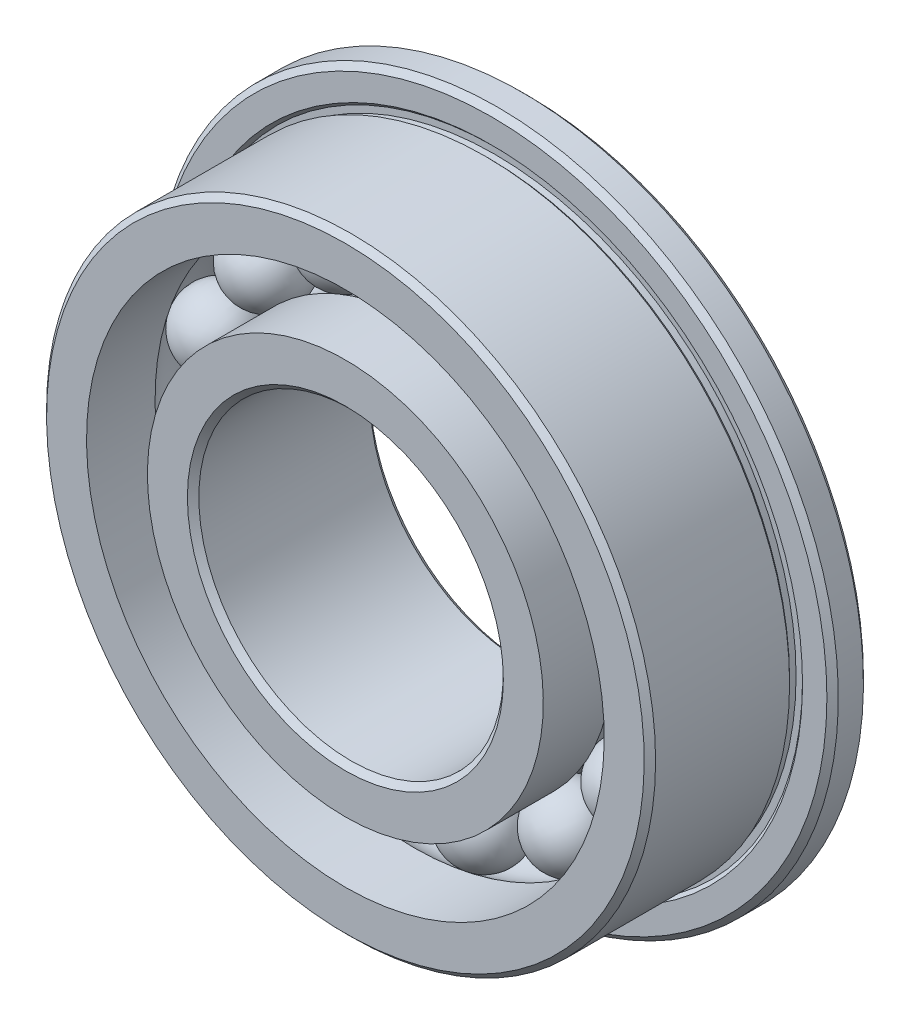
from build123d import *

# Parameters (mm, degrees)
FILLET1_SIZE      = 0.09375
FILLET2_SIZE      = 0.09375
CIRPATTERN3_COUNT = 15


with BuildPart() as part:
    # Sketch2 → Revolve1 (revolve)
    with BuildSketch(Plane(origin=(0, 0, 0), x_dir=(0, 0, -1), z_dir=(1, 0, 0))):
        with BuildLine():
            Line((1.5, 5.6), (0.9, 5.6))
            Line((0.9, 5.6), (0.9, 5.106066017))
            Line((0.9, 5.106066017), (0.953033009, 5.053033009))
            Line((0.953033009, 5.053033009), (0.953033009, 4.946966991))
            Line((0.953033009, 4.946966991), (0.846966991, 4.946966991))
            Line((0.846966991, 4.946966991), (0.793933983, 5))
            Line((0.793933983, 5), (-1.5, 5))
            Line((-1.5, 5), (-1.5, 4.25))
            Line((-1.5, 4.25), (-0.375, 4.25))
            ThreePointArc((-0.375, 4.25), (0, 4.375), (0.375, 4.25))
            Line((0.375, 4.25), (1.5, 4.25))
            Line((1.5, 4.25), (1.5, 5.6))
        make_face()
        with BuildLine():
            Line((1.5, 2.5), (-1.5, 2.5))
            Line((-1.5, 2.5), (-1.5, 3.25))
            Line((-1.5, 3.25), (-0.375, 3.25))
            ThreePointArc((-0.375, 3.25), (0, 3.125), (0.375, 3.25))
            Line((0.375, 3.25), (1.5, 3.25))
            Line((1.5, 3.25), (1.5, 2.5))
        make_face()
    revolve(axis=Axis((0, 0, 0), (0, 0, -1)))

    # Fillet1
    fillet1_edges = [part.edges().sort_by_distance(p)[0] for p in [
        (0, -5.6, -1.5),
        (0, -5.6, -0.9),
        (0, -5, 1.5),
    ]]
    chamfer(fillet1_edges, length=FILLET1_SIZE)

    # Fillet2
    fillet2_edges = [part.edges().sort_by_distance(p)[0] for p in [
        (0, -2.5, -1.5),
        (0, -2.5, 1.5),
    ]]
    chamfer(fillet2_edges, length=FILLET2_SIZE)


with BuildPart() as body_2:
    # Sketch7 → Revolve3 (revolve)
    with BuildSketch(Plane.XY):
        with BuildLine():
            Line((0, 4.375), (0, 3.125))
            ThreePointArc((0, 3.125), (-0.625, 3.75), (0, 4.375))
        make_face()
    revolve(axis=Axis((0, 4.375, 0), (0, -1, 0)))


with BuildPart() as cirpattern3_1:
    # CirPattern3: pattern copy
    add(body_2.part.rotate(Axis((0, 0, 0), (0, 0, -1)), 1 * 360 / CIRPATTERN3_COUNT))


with BuildPart() as cirpattern3_2:
    # CirPattern3: pattern copy
    add(body_2.part.rotate(Axis((0, 0, 0), (0, 0, -1)), 2 * 360 / CIRPATTERN3_COUNT))


with BuildPart() as cirpattern3_3:
    # CirPattern3: pattern copy
    add(body_2.part.rotate(Axis((0, 0, 0), (0, 0, -1)), 3 * 360 / CIRPATTERN3_COUNT))


with BuildPart() as cirpattern3_4:
    # CirPattern3: pattern copy
    add(body_2.part.rotate(Axis((0, 0, 0), (0, 0, -1)), 4 * 360 / CIRPATTERN3_COUNT))


with BuildPart() as cirpattern3_5:
    # CirPattern3: pattern copy
    add(body_2.part.rotate(Axis((0, 0, 0), (0, 0, -1)), 5 * 360 / CIRPATTERN3_COUNT))


with BuildPart() as cirpattern3_6:
    # CirPattern3: pattern copy
    add(body_2.part.rotate(Axis((0, 0, 0), (0, 0, -1)), 6 * 360 / CIRPATTERN3_COUNT))


with BuildPart() as cirpattern3_7:
    # CirPattern3: pattern copy
    add(body_2.part.rotate(Axis((0, 0, 0), (0, 0, -1)), 7 * 360 / CIRPATTERN3_COUNT))


with BuildPart() as cirpattern3_8:
    # CirPattern3: pattern copy
    add(body_2.part.rotate(Axis((0, 0, 0), (0, 0, -1)), 8 * 360 / CIRPATTERN3_COUNT))


with BuildPart() as cirpattern3_9:
    # CirPattern3: pattern copy
    add(body_2.part.rotate(Axis((0, 0, 0), (0, 0, -1)), 9 * 360 / CIRPATTERN3_COUNT))


with BuildPart() as cirpattern3_10:
    # CirPattern3: pattern copy
    add(body_2.part.rotate(Axis((0, 0, 0), (0, 0, -1)), 10 * 360 / CIRPATTERN3_COUNT))


with BuildPart() as cirpattern3_11:
    # CirPattern3: pattern copy
    add(body_2.part.rotate(Axis((0, 0, 0), (0, 0, -1)), 11 * 360 / CIRPATTERN3_COUNT))


with BuildPart() as cirpattern3_12:
    # CirPattern3: pattern copy
    add(body_2.part.rotate(Axis((0, 0, 0), (0, 0, -1)), 12 * 360 / CIRPATTERN3_COUNT))


with BuildPart() as cirpattern3_13:
    # CirPattern3: pattern copy
    add(body_2.part.rotate(Axis((0, 0, 0), (0, 0, -1)), 13 * 360 / CIRPATTERN3_COUNT))


with BuildPart() as cirpattern3_14:
    # CirPattern3: pattern copy
    add(body_2.part.rotate(Axis((0, 0, 0), (0, 0, -1)), 14 * 360 / CIRPATTERN3_COUNT))


solid = Compound([part.part, body_2.part, cirpattern3_1.part, cirpattern3_2.part, cirpattern3_3.part, cirpattern3_4.part, cirpattern3_5.part, cirpattern3_6.part, cirpattern3_7.part, cirpattern3_8.part, cirpattern3_9.part, cirpattern3_10.part, cirpattern3_11.part, cirpattern3_12.part, cirpattern3_13.part, cirpattern3_14.part])
